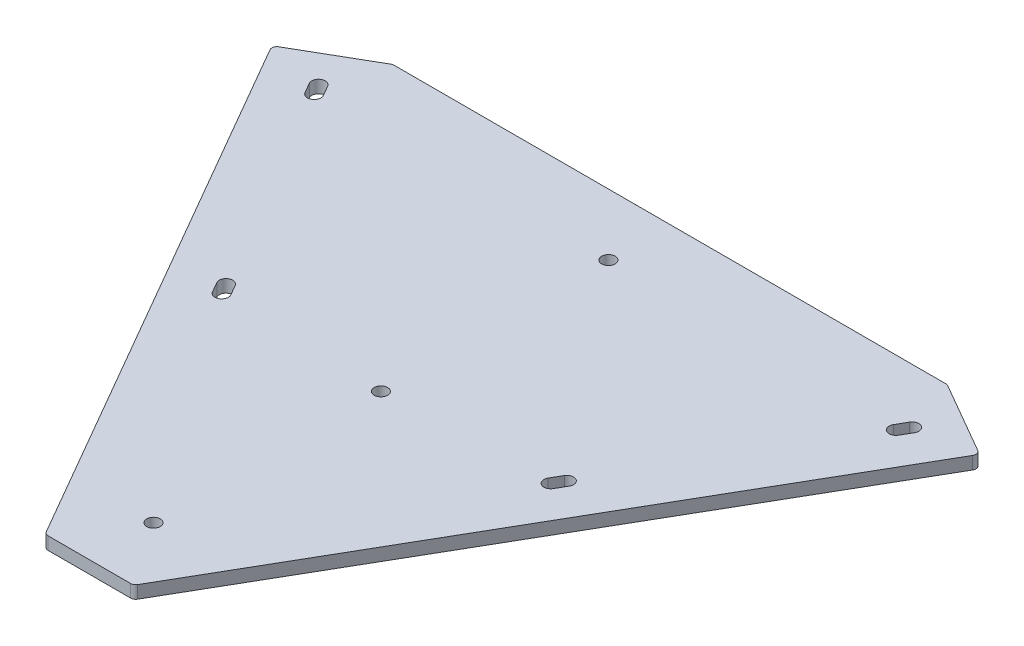
from build123d import *

# Parameters (mm, degrees)
BOSS_EXTRUDE1_DEPTH     = 6.35
F_1_4_CLEARANCE_HOLE1_D = 6.7564
CUT_EXTRUDE1_DEPTH      = 376.065853402
FILLET1_R               = 2.54


with BuildPart() as part:
    # Sketch1 → Boss-Extrude1 (new body)
    with BuildSketch(Plane(origin=(0, 0, 0), x_dir=(1, 0, 0), z_dir=(0, 1, 0))):
        Polygon((-177.8, 307.958633586), (-22.225, 38.494829198), (22.225, 38.494829198), (177.8, 307.958633586), (139.305170802, 330.183633586), (-139.305170802, 330.183633586), align=None)
    extrude(amount=BOSS_EXTRUDE1_DEPTH)

    # 1/4 Clearance Hole1 (through all)
    with Locations(Plane(origin=(0, 6.35, 0), x_dir=(1, 0, 0), z_dir=(0, 1, 0))):
        with Locations((0, 299.260881198), (0, 70.660881198), (0, 184.960881198)):
            Hole(F_1_4_CLEARANCE_HOLE1_D / 2)

    # Sketch6 → Cut-Extrude1 (cut, through all)
    with BuildSketch(Plane(origin=(0, 6.35, 0), x_dir=(1, 0, 0), z_dir=(0, 1, 0))):
        with BuildLine():
            Line((-146.190878382, 304.41642896), (-143.219078382, 299.269120371))
            ThreePointArc((-143.219078382, 299.269120371), (-144.455585401, 294.654413351), (-149.07029242, 295.890920371))
            Line((-149.07029242, 295.890920371), (-152.04209242, 301.03822896))
            ThreePointArc((-152.04209242, 301.03822896), (-150.805585401, 305.65293598), (-146.190878382, 304.41642896))
        make_face()
        with BuildLine():
            Line((-85.57029242, 185.90569409), (-88.54209242, 191.05300268))
            ThreePointArc((-88.54209242, 191.05300268), (-87.305585401, 195.667709699), (-82.690878382, 194.43120268))
            Line((-82.690878382, 194.43120268), (-79.719078382, 189.28389409))
            ThreePointArc((-79.719078382, 189.28389409), (-80.955585401, 184.669187071), (-85.57029242, 185.90569409))
        make_face()
        with BuildLine():
            Line((146.190878382, 304.41642896), (143.219078382, 299.269120371))
            ThreePointArc((143.219078382, 299.269120371), (144.455585401, 294.654413351), (149.07029242, 295.890920371))
            Line((149.07029242, 295.890920371), (152.04209242, 301.03822896))
            ThreePointArc((152.04209242, 301.03822896), (150.805585401, 305.65293598), (146.190878382, 304.41642896))
        make_face()
        with BuildLine():
            Line((85.57029242, 185.90569409), (88.54209242, 191.05300268))
            ThreePointArc((88.54209242, 191.05300268), (87.305585401, 195.667709699), (82.690878382, 194.43120268))
            Line((82.690878382, 194.43120268), (79.719078382, 189.28389409))
            ThreePointArc((79.719078382, 189.28389409), (80.955585401, 184.669187071), (85.57029242, 185.90569409))
        make_face()
    extrude(amount=-CUT_EXTRUDE1_DEPTH, mode=Mode.SUBTRACT)

    # Fillet1
    fillet1_edges = [part.edges().sort_by_distance(p)[0] for p in [
        (22.225, 3.175, -38.494829198),
        (-22.225, 3.175, -38.494829198),
        (-139.305170802, 3.175, -330.183633586),
        (139.305170802, 3.175, -330.183633586),
        (177.8, 3.175, -307.958633586),
        (-177.8, 3.175, -307.958633586),
    ]]
    fillet(fillet1_edges, radius=FILLET1_R)


solid = part.part
